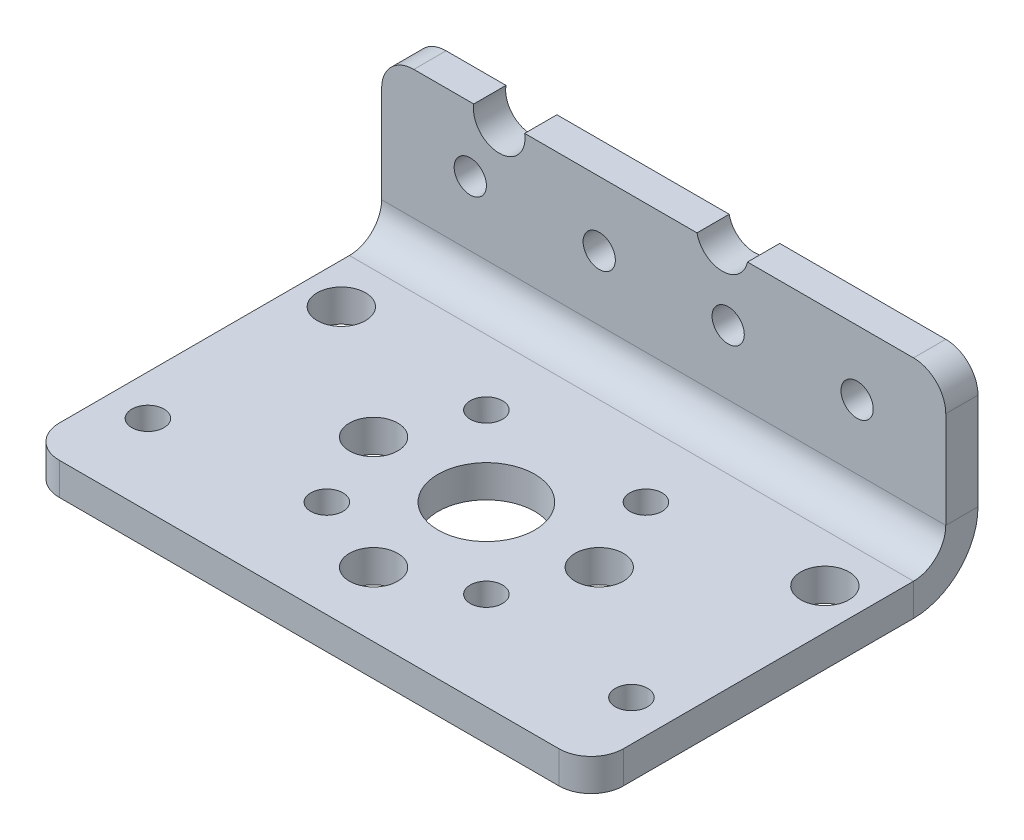
from build123d import *

# Parameters (mm, degrees)
SKETCH1_W                    = 35
SKETCH1_H                    = 12
BASE_FLANGE1_DEPTH           = 2
EDGE_FLANGE1_STRIP_W         = 12
EDGE_FLANGE1_STRIP_H         = 2
EDGE_FLANGE1_STRIP_CUT_DEPTH = 35
EDGE_FLANGE1_DEPTH           = 35
FILLET1_R                    = 2
SKETCH9_R                    = 1
CUT_EXTRUDE1_DEPTH           = 10
SKETCH10_R                   = 3
SKETCH10_R_2                 = 1.5
SKETCH10_R_3                 = 1
CUT_EXTRUDE2_DEPTH           = 10
SKETCH11_R                   = 1.6
CUT_EXTRUDE3_DEPTH           = 10


# Sheet-metal steps are written as plain solids
with BuildPart() as part:
    # Sketch1 → Base-Flange1 (new body)
    with BuildSketch(Plane.XY):
        Rectangle(SKETCH1_W, SKETCH1_H)
    extrude(amount=-BASE_FLANGE1_DEPTH)

    # Edge-Flange1 strip (across the edge) → Edge-Flange1 strip cut (cut)
    with BuildSketch(Plane(origin=(-17.5, -6, 0), x_dir=(0, 1, 0), z_dir=(1, 0, 0))):
        with Locations((-2, -1)):
            Rectangle(EDGE_FLANGE1_STRIP_W, EDGE_FLANGE1_STRIP_H)
    extrude(amount=EDGE_FLANGE1_STRIP_CUT_DEPTH, mode=Mode.SUBTRACT)

    # Edge-Flange1 section (across the edge) → Edge-Flange1 (add)
    with BuildSketch(Plane(origin=(-17.5, -6, 0), x_dir=(0, 1, 0), z_dir=(1, 0, 0))):
        with BuildLine():
            Line((0, 2), (0, 22))
            Line((0, 22), (2, 22))
            Line((2, 22), (2, 2))
            ThreePointArc((2, 2), (2.585786438, 0.585786438), (4, 0))
            Line((4, 0), (4, -2))
            ThreePointArc((4, -2), (1.171572875, -0.828427125), (0, 2))
        make_face()
    extrude(amount=EDGE_FLANGE1_DEPTH)

    # Fillet1
    fillet1_edges = [part.edges().sort_by_distance(p)[0] for p in [
        (-17.5, -5, 22),
        (17.5, -5, 22),
        (-17.5, 6, -1),
        (17.5, 6, -1),
    ]]
    fillet(fillet1_edges, radius=FILLET1_R)

    # Sketch9 → Cut-Extrude1 (cut)
    with BuildSketch(Plane(origin=(0, 0, -2), x_dir=(-1, 0, 0), z_dir=(0, 0, -1))):
        with Locations((4, 2)):
            Circle(SKETCH9_R)
        with Locations((12, 2)):
            Circle(SKETCH9_R)
        with Locations(Location((-12, 2, 0), (0, 0, 180))):
            Circle(SKETCH9_R)
        with Locations(Location((-4, 2, 0), (0, 0, 180))):
            Circle(SKETCH9_R)
    extrude(amount=-CUT_EXTRUDE1_DEPTH, mode=Mode.SUBTRACT)

    # Sketch10 → Cut-Extrude2 (cut)
    with BuildSketch(Plane.XZ.offset(6)):
        with Locations(Location((0, 11, 0), (0, 0, 270))):
            Circle(SKETCH10_R)
        with Locations(Location((-7, 11, 0), (0, 0, 270))):
            Circle(SKETCH10_R_2)
        with Locations(Location((-15, 5, 0), (0, 0, 270))):
            Circle(SKETCH10_R_2)
        with Locations(Location((-15, 17, 0), (0, 0, 270))):
            Circle(SKETCH10_R_3)
        with Locations(Location((-4.949747468, 15.949747468, 0), (0, 0, 270))):
            Circle(SKETCH10_R_3)
        with Locations(Location((-4.949747468, 6.050252532, 0), (0, 0, 270))):
            Circle(SKETCH10_R_3)
        with Locations(Location((0, 18, 0), (0, 0, 270))):
            Circle(SKETCH10_R_2)
        with Locations(Location((15, 17, 0), (0, 0, 90))):
            Circle(SKETCH10_R_3)
        with Locations(Location((15, 5, 0), (0, 0, 90))):
            Circle(SKETCH10_R_2)
        with Locations(Location((4.949747468, 6.050252532, 0), (0, 0, 90))):
            Circle(SKETCH10_R_3)
        with Locations(Location((7, 11, 0), (0, 0, 90))):
            Circle(SKETCH10_R_2)
        with Locations(Location((4.949747468, 15.949747468, 0), (0, 0, 90))):
            Circle(SKETCH10_R_3)
    extrude(amount=-CUT_EXTRUDE2_DEPTH, mode=Mode.SUBTRACT)

    # Sketch11 → Cut-Extrude3 (cut)
    with BuildSketch(Plane.XY):
        with Locations((-10.205953252, 5.743869118)):
            Circle(SKETCH11_R)
        with Locations((3.631753083, 6.323821502)):
            Circle(SKETCH11_R)
    extrude(amount=-CUT_EXTRUDE3_DEPTH, mode=Mode.SUBTRACT)


solid = part.part
